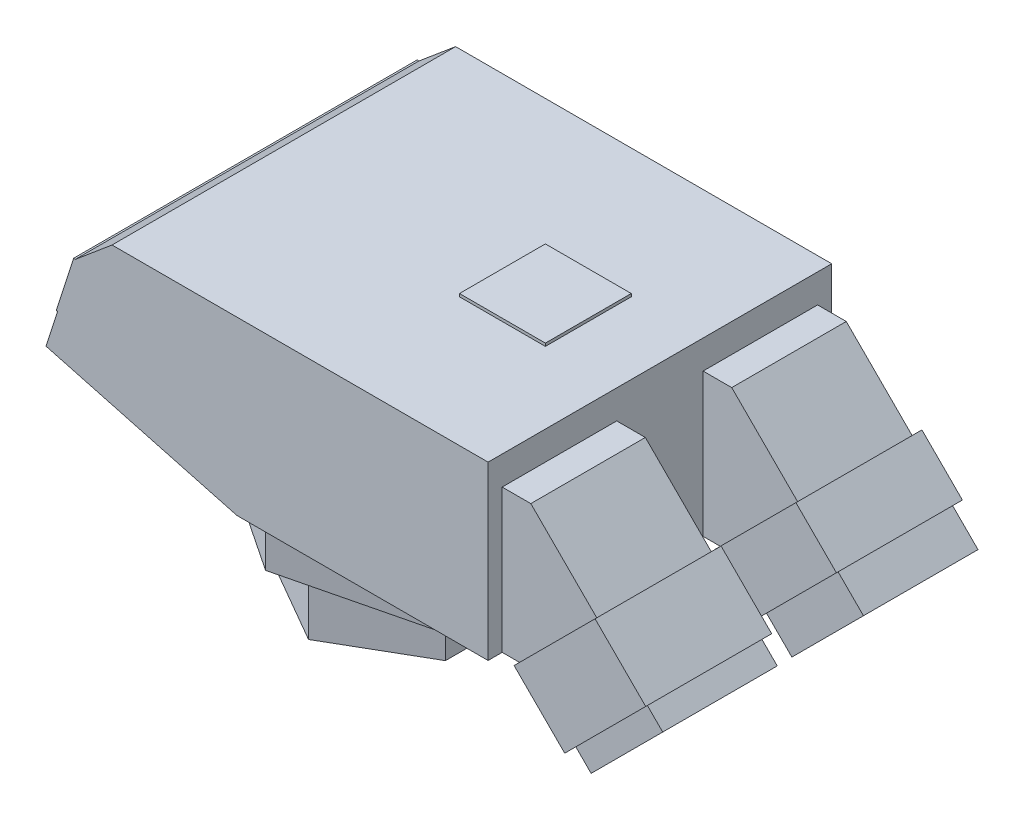
from build123d import *

# Parameters (mm, degrees)
SKETCH1_W                 = 7.62
SKETCH1_H                 = 7.62
BOSS_EXTRUDE1_DEPTH       = 0.254
SKETCH2_W                 = 7.62
SKETCH2_H                 = 7.62
BOSS_EXTRUDE2_DEPTH       = 15.24
CHAMFER1_SIZE             = 7.62
CHAMFER1_SIZE2            = 4.399409051
CHAMFER2_SIZE             = 3.81
CHAMFER2_SIZE2            = 7.16045777
BOSS_EXTRUDE5_DEPTH       = 12.7
SKETCH7_W                 = 10.16
SKETCH7_H                 = 12.7
BOSS_EXTRUDE7_DEPTH       = 2.54
SWEEP1_START              = 0.02132645
SWEEP1_DEPTH              = 10.16
SWEEP2_START              = -17.80132645
SWEEP2_DEPTH              = 10.16
BOSS_EXTRUDE9_DEPTH       = 0.508
SKETCH12_W                = 11.176
SKETCH12_H                = 5.08
BOSS_EXTRUDE11_DEPTH      = 10.16
BOSS_EXTRUDE12_DEPTH      = 0.508
SKETCH14_W                = 11.176
SKETCH14_H                = 6.35
BOSS_EXTRUDE13_DEPTH      = 10.16
SKETCH17_W                = 30.48
SKETCH17_H                = 15.24
BOSS_EXTRUDE16_DEPTH      = 40.64
CHAMFER10_SIZE            = 15.08
CHAMFER10_SIZE2           = 4.899789019
CHAMFER11_SIZE            = 4.92
CHAMFER11_SIZE_2          = 18.361689973
CHAMFER12_SIZE            = 2.38
CHAMFER12_SIZE2           = 2.886919979
CUT_EXTRUDE1_DEPTH        = 12.7
BOSS_EXTRUDE17_DEPTH      = 12.7
BOSS_EXTRUDE17_DEPTH_BACK = 5.08
CHAMFER14_SIZE            = 10.16
CHAMFER14_SIZE_2          = 37.917636205
BOSS_EXTRUDE18_DEPTH      = 12.7
SKETCH22_W                = 30.48
SKETCH22_H                = 5.030470453
BOSS_EXTRUDE19_DEPTH      = 0.127


# Read off the part's stored shape, not the designer's step: Sweep1, Sweep2
with BuildPart() as part:
    # Sketch1 → Boss-Extrude1 (new body)
    with BuildSketch(Plane(origin=(0, 0, 0), x_dir=(1, 0, 0), z_dir=(0, 1, 0))):
        with Locations((3.81, 3.81)):
            Rectangle(SKETCH1_W, SKETCH1_H)
    extrude(amount=BOSS_EXTRUDE1_DEPTH)

    # Sketch2 → Boss-Extrude2 (add)
    with BuildSketch(Plane.XZ):
        Polygon((7.62, -7.62), (3.81, -7.62), (3.81, -19.05), (13.97, -19.05), (13.97, 11.43), (3.81, 11.43), (3.81, 0), (7.62, 0), align=None)
        Polygon((3.81, -19.05), (3.81, -7.62), (0, -7.62), (0, 0), (3.81, 0), (3.81, 11.43), (-11.525577389, 11.43), (-11.525577389, -19.05), align=None)
        with Locations((3.81, -3.81)):
            Rectangle(SKETCH2_W, SKETCH2_H)
    extrude(amount=BOSS_EXTRUDE2_DEPTH)

    # Chamfer1
    chamfer1_edges = [part.edges().sort_by_distance(p)[0] for p in [
        (-11.525577389, 0, -3.81),
    ]]
    chamfer1_side = [part.faces().sort_by_distance(p)[0] for p in [
        (1.222211305, 0, -18.652626767),
    ]]
    chamfer(chamfer1_edges, length=CHAMFER1_SIZE, length2=CHAMFER1_SIZE2, reference=chamfer1_side[0])

    # Chamfer2
    chamfer2_edges = [part.edges().sort_by_distance(p)[0] for p in [
        (-11.525577389, -4.399409051, -3.81),
    ]]
    chamfer2_side = [part.faces().sort_by_distance(p)[0] for p in [
        (-7.715577389, -2.199704526, -3.81),
    ]]
    chamfer(chamfer2_edges, length=CHAMFER2_SIZE, length2=CHAMFER2_SIZE2, reference=chamfer2_side[0])

    # Sketch3 → Boss-Extrude5 (add)
    with BuildSketch(Plane.XZ.offset(15.24)):
        Polygon((1.222211305, -13.998435267), (10.045655072, -8.904217634), (10.045655072, 1.284217634), (1.222211305, 6.378435267), (-7.601232461, 1.284217634), (-7.601232461, -8.904217634), align=None)
    extrude(amount=BOSS_EXTRUDE5_DEPTH)

    # Sketch7 → Boss-Extrude7 (add)
    with BuildSketch(Plane(origin=(13.97, 0, 0), x_dir=(0, 0, -1), z_dir=(1, 0, 0))):
        Polygon((-3.81, -7.62), (-0.02132645, -7.62), (-0.02132645, -2.54), (-10.18132645, -2.54), (-10.18132645, -7.62), align=None)
        Polygon((-3.83132645, -15.24), (-3.81, -7.62), (-10.18132645, -7.62), (-10.18132645, -15.24), align=None)
        Polygon((-0.02132645, -15.24), (-0.02132645, -7.62), (-3.81, -7.62), (-3.83132645, -15.24), align=None)
        with Locations((12.72132645, -8.89)):
            Rectangle(SKETCH7_W, SKETCH7_H)
    extrude(amount=BOSS_EXTRUDE7_DEPTH)

    # Sweep1 outline → Sweep1 (add)
    with BuildSketch(Plane.XY.offset(SWEEP1_START)):
        Polygon((16.51, -15.24), (29.045138309, -27.775138309), (29.045138309, -15.075138309), (16.51, -2.54), align=None)
    extrude(amount=SWEEP1_DEPTH)

    # Sweep2 outline → Sweep2 (add)
    with BuildSketch(Plane.XY.offset(SWEEP2_START)):
        Polygon((16.51, -2.54), (16.51, -15.24), (29.030018127, -27.760018127), (29.030018127, -15.060018127), align=None)
    extrude(amount=SWEEP2_DEPTH)

    # Chamfer5
    # the kernel refuses this chamfer: 14.368409794, 10.16 mm, written as the material it takes off along each edge
    with BuildSketch(Plane(origin=(29.045138309, -27.775138309, 0.02132645), x_dir=(-0.7459142715976749, 0.6660419652145878, 0), z_dir=(0, 0, 1)), Plane(origin=(29.030018127, -27.760018127, -17.80132645), x_dir=(-0.7459142715976752, 0.6660419652145875, 0), z_dir=(0, 0, 1))) as chamfer5_piece_1:
        with BuildLine():
            Line((10.176243016, 0), (9.537503791, -11.29142094))
            Line((9.537503791, -11.29142094), (9.323151752, -11.482820218))
            ThreePointArc((9.323151752, -11.482820218), (4.705969637, -5.701770021), (-0.214352039, -0.191399278))
            Line((-0.214352039, -0.191399278), (0.016230053, 0.286909507))
            ThreePointArc((0.016230053, 0.286909507), (5.088121508, 0), (10.192473069, 0.286909507))
            Line((10.192473069, 0.286909507), (10.176243016, 0))
        make_face()
    extrude(amount=10.16, mode=Mode.SUBTRACT)

    # Sketch10 → Boss-Extrude9 (add)
    with BuildSketch(Plane(origin=(6.985, 6.985, 0), x_dir=(0, 0, -1), z_dir=(0.7071067811865389, 0.7071067811865561, 0))):
        Polygon((12.72132645, -21.73350196), (18.30932645, -21.73350196), (18.30932645, -26.81350196), (7.13332645, -26.81350196), (7.13332645, -21.73350196), align=None)
    extrude(amount=BOSS_EXTRUDE9_DEPTH)

    # Sketch12 → Boss-Extrude11 (add)
    with BuildSketch(Plane(origin=(7.344210245, 7.344210245, 0), x_dir=(0, 0, -1), z_dir=(0.707106781186539, 0.707106781186556, 0))):
        with Locations((12.72132645, -24.27350196)):
            Rectangle(SKETCH12_W, SKETCH12_H)
    extrude(amount=-BOSS_EXTRUDE11_DEPTH)

    # Sketch13 → Boss-Extrude12 (add)
    with BuildSketch(Plane(origin=(6.985, 6.985, 0), x_dir=(0, 0, -1), z_dir=(0.7071067811865389, 0.7071067811865562, 0))):
        Polygon((-5.10132645, -21.744193544), (-10.68932645, -21.744193544), (-10.68932645, -28.094193544), (0.48667355, -28.094193544), (0.48667355, -21.744193544), align=None)
    extrude(amount=BOSS_EXTRUDE12_DEPTH)

    # Sketch14 → Boss-Extrude13 (add)
    with BuildSketch(Plane(origin=(7.344210245, 7.344210245, 0), x_dir=(0, 0, -1), z_dir=(0.7071067811865388, 0.7071067811865562, 0))):
        with Locations((-5.10132645, -24.919193544)):
            Rectangle(SKETCH14_W, SKETCH14_H)
    extrude(amount=-BOSS_EXTRUDE13_DEPTH)

    # Sketch17 → Boss-Extrude16 (add)
    with BuildSketch(Plane(origin=(13.97, 0, 0), x_dir=(0, 0, -1), z_dir=(1, 0, 0))):
        with Locations((3.81, -7.62)):
            Rectangle(SKETCH17_W, SKETCH17_H)
    extrude(amount=-BOSS_EXTRUDE16_DEPTH)

    # Chamfer10
    chamfer10_edges = [part.edges().sort_by_distance(p)[0] for p in [
        (-26.67, 0, -3.81),
    ]]
    chamfer10_side = [part.faces().sort_by_distance(p)[0] for p in [
        (-26.67, -7.62, -3.81),
    ]]
    chamfer(chamfer10_edges, length=CHAMFER10_SIZE, length2=CHAMFER10_SIZE2, reference=chamfer10_side[0])

    # Chamfer11
    # the kernel refuses this chamfer: 18.361689973, 4.92 mm, written as the material it takes off along each edge
    with BuildSketch(Plane(origin=(-26.67, -15.24, -66.730196419), x_dir=(-0.13751244702129126, 0.990500038825954, 0), z_dir=(0, 0, 1))) as chamfer11_piece_1:
        Polygon((CHAMFER11_SIZE * 0.990500038826, -CHAMFER11_SIZE * 0.137512447021), (-CHAMFER11_SIZE_2 * 0.137512447023, -CHAMFER11_SIZE_2 * 0.990500038839), (0, 0), align=None)
    extrude(amount=125.840392838, mode=Mode.SUBTRACT)

    # Chamfer12
    chamfer12_edges = [part.edges().sort_by_distance(p)[0] for p in [
        (-21.770210981, 0, -3.81),
    ]]
    chamfer12_side = [part.faces().sort_by_distance(p)[0] for p in [
        (-4.334202117, 0, -3.81),
    ]]
    chamfer(chamfer12_edges, length=CHAMFER12_SIZE, length2=CHAMFER12_SIZE2, reference=chamfer12_side[0])

    # Sketch19 → Cut-Extrude1 (cut)
    with BuildSketch(Plane.XZ.offset(27.94)):
        Polygon((-7.601232461, 1.284217634), (-7.601232461, -8.904217634), (1.222211305, -13.998435267), (10.045655072, -8.904217634), (10.045655072, 1.284217634), (1.222211305, 6.378435267), align=None)
    extrude(amount=-CUT_EXTRUDE1_DEPTH, mode=Mode.SUBTRACT)

    # Sketch20 → Boss-Extrude17 (add, two sides: drawn at the far end of the back side and taken through both)
    with BuildSketch(Plane(origin=(0, -15.24, 0), x_dir=(-1, 0, 0), z_dir=(0, -1, 0)).offset(-BOSS_EXTRUDE17_DEPTH_BACK)):
        Polygon((8.308310027, -8.89), (19.306832655, -2.54), (19.306832655, 10.16), (8.308310027, 16.51), (-2.690212601, 10.16), (-2.690212601, -2.54), align=None)
    extrude(amount=BOSS_EXTRUDE17_DEPTH + BOSS_EXTRUDE17_DEPTH_BACK)

    # Chamfer14
    # the kernel refuses this chamfer: 37.917636205, 10.16 mm, written as the material it takes off along each edge
    with BuildSketch(Plane(origin=(-19.306832655, -27.94, 101.001543824), x_dir=(-0.13751244702129076, 0.9905000388259542, 0), z_dir=(0, 0, -1))) as chamfer14_piece_1:
        Polygon((CHAMFER14_SIZE * 0.990500038826, CHAMFER14_SIZE * 0.137512447021), (-CHAMFER14_SIZE_2 * 0.137512447021, CHAMFER14_SIZE_2 * 0.990500038823), (0, 0), align=None)
    extrude(amount=209.623087649, mode=Mode.SUBTRACT)

    # Sketch21 → Boss-Extrude18 (add)
    with BuildSketch(Plane(origin=(0, -15.24, 0), x_dir=(-1, 0, 0), z_dir=(0, -1, 0))):
        Polygon((8.308310027, -5.08), (16.007275866, -0.635), (16.007275866, 8.255), (8.308310027, 12.7), (0.609344187, 8.255), (0.609344187, -0.635), align=None)
    extrude(amount=BOSS_EXTRUDE18_DEPTH)

    # Sketch22 → Boss-Extrude19 (add)
    with BuildSketch(Plane(origin=(-19.691340818, 6.398104477, 0), x_dir=(0, 0, 1), z_dir=(-0.9510565162951544, 0.30901699437494484, 0))):
        with Locations((-3.81, -12.129520369)):
            Rectangle(SKETCH22_W, SKETCH22_H)
    extrude(amount=BOSS_EXTRUDE19_DEPTH)


solid = part.part
